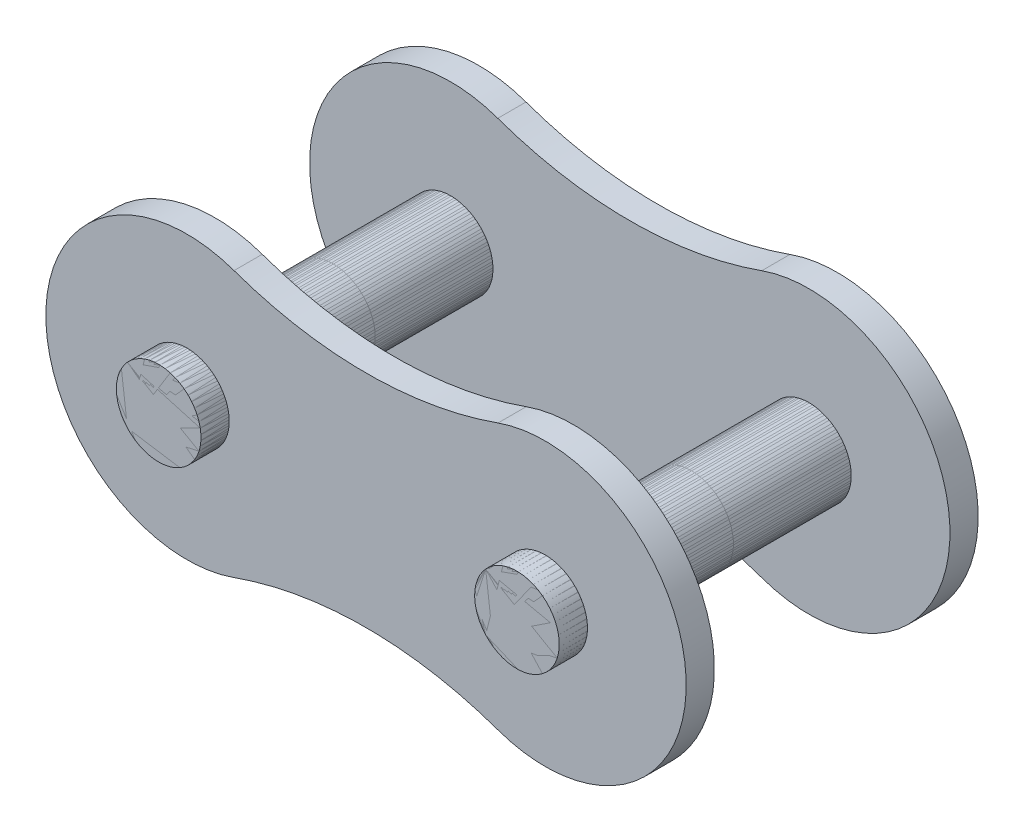
from build123d import *

# Parameters (mm, degrees)
SKETCH1_R                = 0.75
BOSS_EXTRUDE1_DEPTH      = 0.5
BOSS_EXTRUDE2_DEPTH      = 5.175
BOSS_EXTRUDE2_DEPTH_BACK = 1
SKETCH2_R                = 0.75


with BuildPart() as part:
    # Sketch1 → Boss-Extrude1 (new body)
    with BuildSketch(Plane.XY):
        with BuildLine():
            ThreePointArc((0.835526316, 2.356246119), (-2.5, 0), (0.835526316, -2.356246119))
            ThreePointArc((0.835526316, -2.356246119), (3.175, -1.953735254), (5.514473684, -2.356246119))
            ThreePointArc((5.514473684, -2.356246119), (8.85, 0), (5.514473684, 2.356246119))
            ThreePointArc((5.514473684, 2.356246119), (3.175, 1.953735254), (0.835526316, 2.356246119))
        make_face()
        Circle(SKETCH1_R, mode=Mode.SUBTRACT)
        with Locations((6.35, 0)):
            Circle(SKETCH1_R, mode=Mode.SUBTRACT)
    extrude(amount=BOSS_EXTRUDE1_DEPTH)

    # Sketch2 → Boss-Extrude2 (add, two sides: drawn at the far end of the back side and taken through both)
    with BuildSketch(Plane(origin=(0, 0, 0), x_dir=(-1, 0, 0), z_dir=(0, 0, -1)).offset(-BOSS_EXTRUDE2_DEPTH_BACK)):
        with Locations((-6.35, 0)):
            Circle(SKETCH2_R)
        Circle(SKETCH2_R)
    extrude(amount=BOSS_EXTRUDE2_DEPTH + BOSS_EXTRUDE2_DEPTH_BACK)


with BuildPart() as body_2:
    # Mirror1: mirrored copy
    add(part.part.mirror(Plane(origin=(0, 0, -2.0875), x_dir=(1, 0, 0), z_dir=(0, 0, -1))))


solid = Compound([part.part, body_2.part])
